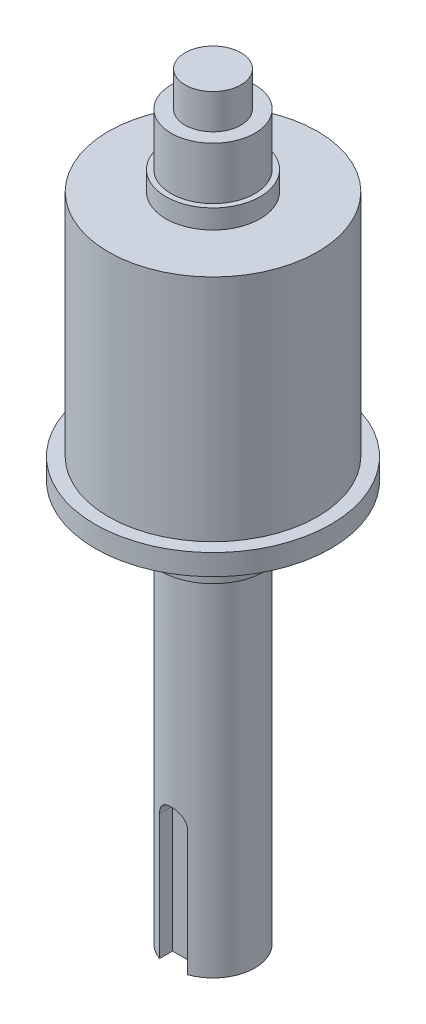
from build123d import *

# Parameters (mm, degrees)
CUT_EXTRUDE1_DEPTH = 15
CUT_EXTRUDE2_DEPTH = 112.842932653


with BuildPart() as part:
    # Sketch2 → Revolve1 (revolve)
    with BuildSketch(Plane.XY):
        Polygon((0, 0), (-4, 0), (-4, -5), (-6, -5), (-6, -12.5), (-6.75, -12.5), (-6.75, -15.25), (-14.9815, -15.25), (-14.9815, -48.11), (-16.8815, -48.11), (-16.8815, -51.11), (-8.25, -51.11), (-8.25, -53.61), (-7.5, -53.61), (-7.5, -58.61), (-6, -58.61), (-6, -108.61), (0, -108.61), align=None)
    revolve(axis=Axis((0, 40.033449689, 0), (0, -1, 0)))

    # Sketch3 → Cut-Extrude1 (cut)
    with BuildSketch(Plane.XZ.offset(108.61)):
        with BuildLine():
            Line((-2, 5.656854249), (-2, 3.8))
            Line((-2, 3.8), (2, 3.8))
            Line((2, 3.8), (2, 5.656854249))
            ThreePointArc((2, 5.656854249), (0, 6), (-2, 5.656854249))
        make_face()
    extrude(amount=-CUT_EXTRUDE1_DEPTH, mode=Mode.SUBTRACT)

    # Sketch4 → Cut-Extrude2 (cut, through all)
    with BuildSketch(Plane.XY.offset(3.8)):
        with BuildLine():
            Line((-2, -93.61), (-2, -90.61))
            ThreePointArc((-2, -90.61), (0, -88.61), (2, -90.61))
            Line((2, -90.61), (2, -93.61))
            Line((2, -93.61), (2, -108.61))
            Line((2, -108.61), (-2, -108.61))
            Line((-2, -108.61), (-2, -93.61))
        make_face()
    extrude(amount=CUT_EXTRUDE2_DEPTH, mode=Mode.SUBTRACT)


solid = part.part
